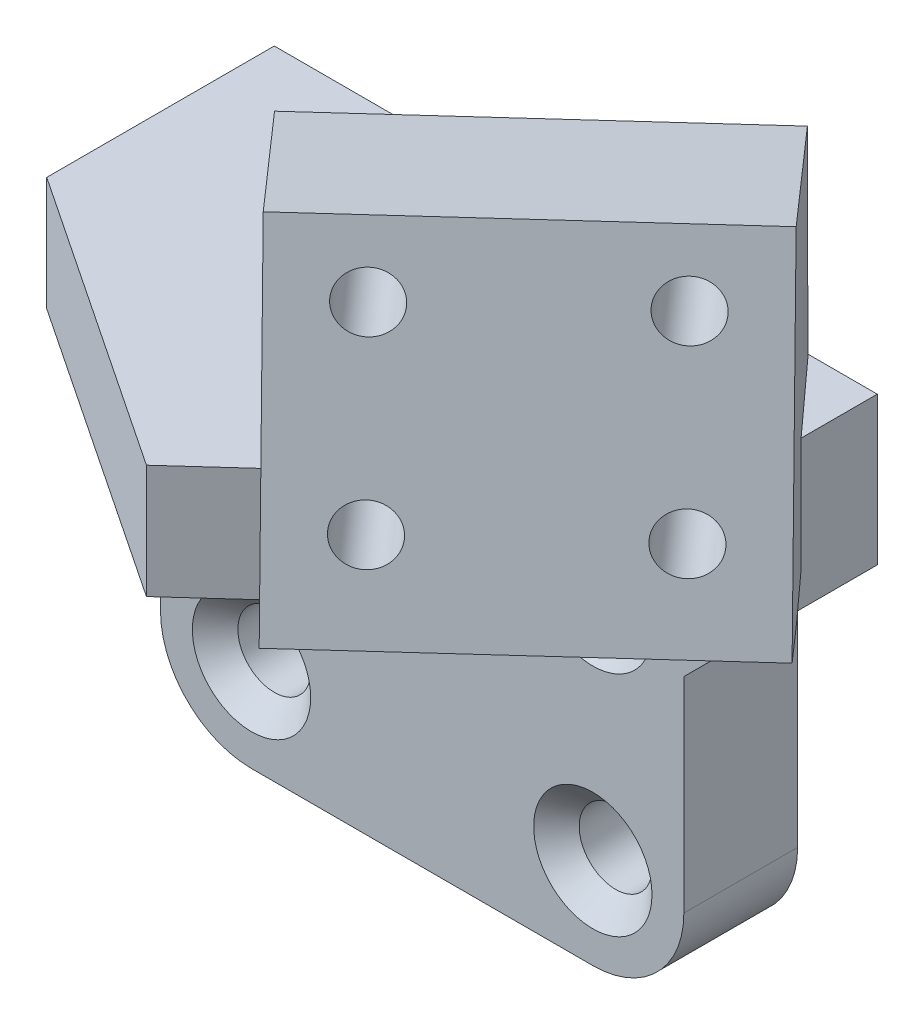
from build123d import *

# Parameters (mm, degrees)
SKETCH1_W           = 23
SKETCH1_H           = 18
SKETCH1_R           = 1.6
BOSS_EXTRUDE1_DEPTH = 5
BOSS_EXTRUDE2_DEPTH = 5
CHAMFER1_SIZE       = 5
CHAMFER2_SIZE       = 1
SKETCH4_W           = 16.579972654
SKETCH4_H           = 15
BOSS_EXTRUDE3_DEPTH = 2.5
BOSS_EXTRUDE4_DEPTH = 16.579972653
SKETCH6_R           = 1.2
CUT_EXTRUDE1_DEPTH  = 8.5
CHAMFER3_SIZE       = 10
CHAMFER3_SIZE_2     = 15
FILLET1_R           = 4
CHAMFER4_SIZE       = 1
CHAMFER5_SIZE       = 3


with BuildPart() as part:
    # Sketch1 → Boss-Extrude1 (new body)
    with BuildSketch(Plane.XY):
        Rectangle(SKETCH1_W, SKETCH1_H)
        with Locations((-7.5, 5)):
            Circle(SKETCH1_R, mode=Mode.SUBTRACT)
        with Locations((7.5, 5)):
            Circle(SKETCH1_R, mode=Mode.SUBTRACT)
        with Locations((7.5, -5)):
            Circle(SKETCH1_R, mode=Mode.SUBTRACT)
        with Locations((-7.5, -5)):
            Circle(SKETCH1_R, mode=Mode.SUBTRACT)
    extrude(amount=BOSS_EXTRUDE1_DEPTH)

    # Sketch2 → Boss-Extrude2 (add)
    with BuildSketch(Plane(origin=(0, 9, 0), x_dir=(1, 0, 0), z_dir=(0, 1, 0))):
        Polygon((-11.5, 0), (15, 0), (15, -6.643953201), (0.2806612, -20), (-11.5, -20), align=None)
    extrude(amount=BOSS_EXTRUDE2_DEPTH)

    # Chamfer1
    # the kernel refuses this chamfer: 5 mm, written as the material it adds along each edge
    with BuildSketch(Plane(origin=(11.5, 9, 0), x_dir=(0.9996219169112968, 0.027495876610586317, 0), z_dir=(0, 0, 1))) as chamfer1_piece_1_section:
        Polygon((CHAMFER1_SIZE * 0.999621916911, -CHAMFER1_SIZE * 0.0274958766106), (-CHAMFER1_SIZE * 0.0274958766106, -CHAMFER1_SIZE * 0.999621916911), (0, 0), align=None)
    chamfer1_piece_1 = extrude(amount=5, mode=Mode.PRIVATE)
    chamfer1_piece_1 = split(chamfer1_piece_1, bisect_by=Plane(origin=(15, 7.205161253, 2.5), z_dir=(-1, 0, 0)), keep=Keep.TOP, mode=Mode.PRIVATE)
    add(chamfer1_piece_1)

    # Chamfer2
    chamfer2_edges = [part.edges().sort_by_distance(p)[0] for p in [
        (1.75, 9, 5),
    ]]
    chamfer(chamfer2_edges, length=CHAMFER2_SIZE)



with BuildPart() as body_2:
    # Sketch4 → Boss-Extrude3 (new body)
    with BuildSketch(Plane(origin=(11.384560122, 2.987302729, 12.546616529), x_dir=(0.740570076440372, 0, -0.6719791379805639), z_dir=(0.66177026494572, 0.1736481776669273, 0.7293191529273223))):
        with Locations((0.568617942, 13.682585877)):
            Rectangle(SKETCH4_W, SKETCH4_H)
    extrude(amount=BOSS_EXTRUDE3_DEPTH)


with BuildPart() as part_1:
    add(part.part)

    add(body_2.part)  # Boss-Extrude4 merges body 2
    # Sketch5 → Boss-Extrude4 (add)
    with BuildSketch(Plane(origin=(-5.718214375, 0, 5.188598471), x_dir=(0.671979137980564, 0, 0.7405700764403719), z_dir=(-0.7405700764403719, 0, 0.671979137980564))):
        Polygon((13.263518223, 23.84807753), (8.5, 23.008140744), (8.5, 9), (15.437443318, 9), (16.360644765, 9.162785324), (13.7559221, 23.934901619), align=None)
    extrude(amount=-BOSS_EXTRUDE4_DEPTH)

    # Sketch6 → Cut-Extrude1 (cut)
    with BuildSketch(Plane(origin=(13.038985784, 3.421423174, 14.369914411), x_dir=(0.6543934076768378, -0.6084836265000186, -0.44890638697893565), z_dir=(0.6617702649457201, 0.17364817766692736, 0.7293191529273223))):
        with Locations(Location((-14.718789486, 11.558581755, 0), (0, 0, 38.160790932))):
            Circle(SKETCH6_R)
        with Locations(Location((-6.855990457, 17.737286428, 0), (0, 0, 38.160790932))):
            Circle(SKETCH6_R)
        with Locations(Location((-1.913026719, 11.447047204, 0), (0, 0, 38.160790932))):
            Circle(SKETCH6_R)
        with Locations(Location((-9.775825748, 5.268342532, 0), (0, 0, 38.160790932))):
            Circle(SKETCH6_R)
    extrude(amount=-CUT_EXTRUDE1_DEPTH, mode=Mode.SUBTRACT)

    # Chamfer3
    # the kernel refuses this chamfer: 15, 10 mm, written as the material it takes off along each edge
    with BuildSketch(Plane(origin=(-11.5, -29.757007858, 20), x_dir=(-0.048258704095597814, 0, -0.9988348699755197), z_dir=(0, 1, 0))) as chamfer3_piece_1:
        Polygon((CHAMFER3_SIZE * 0.998834869976, -CHAMFER3_SIZE * 0.0482587040956), (-CHAMFER3_SIZE_2 * 0.0482587040956, -CHAMFER3_SIZE_2 * 0.998834869976), (0, 0), align=None)
    extrude(amount=82.514015716, mode=Mode.SUBTRACT)

    # Fillet1
    fillet1_edges = [part_1.edges().sort_by_distance(p)[0] for p in [
        (11.5, -9, 2.5),
        (-11.5, -9, 2.5),
    ]]
    fillet(fillet1_edges, radius=FILLET1_R)

    # Chamfer4
    chamfer4_edges = [part_1.edges().sort_by_distance(p)[0] for p in [
        (-9.1, 5, 5),
        (5.9, 5, 5),
        (5.9, -5, 5),
        (-9.1, -5, 5),
    ]]
    chamfer(chamfer4_edges, length=CHAMFER4_SIZE)

    # Chamfer5
    # the kernel refuses this chamfer: 3 mm, written as the material it adds along each edge
    with BuildSketch(Plane(origin=(-0.006391702, 14, 11.483444121), x_dir=(-0.6717250740325321, -0.02749587661058621, -0.7402900794184701), z_dir=(0.7405700764403719, 0, -0.671979137980564))) as chamfer5_piece_1_section:
        Polygon((CHAMFER5_SIZE * 0.999621916911, CHAMFER5_SIZE * 0.0274958766106), (-CHAMFER5_SIZE * 0.0274958766106, CHAMFER5_SIZE * 0.999621916911), (0, 0), align=None)
    chamfer5_piece_1 = extrude(amount=16.579972653, mode=Mode.PRIVATE)
    chamfer5_piece_1 = split(chamfer5_piece_1, bisect_by=Plane(origin=(5.253450971, 15.007443818, 0), z_dir=(0, 0, 1)), keep=Keep.TOP, mode=Mode.PRIVATE)
    add(chamfer5_piece_1)


solid = part_1.part
